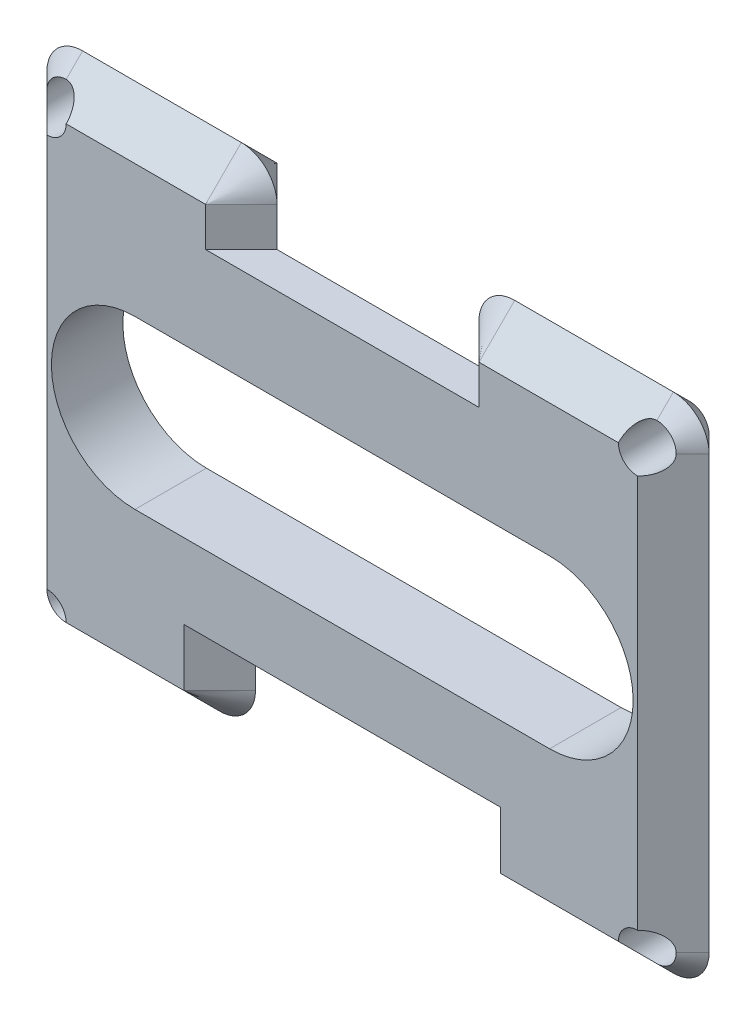
from build123d import *

# Parameters (mm, degrees)
SKETCH2_R           = 5.393909569
BOSS_EXTRUDE1_DEPTH = 10
SKETCH2_2_R         = 5.393909569
BOSS_EXTRUDE2_DEPTH = 20
CHAMFER1_SIZE       = 10
CHAMFER3_SIZE       = 10
CHAMFER4_SIZE       = 10
CHAMFER5_SIZE       = 10
CHAMFER6_SIZE       = 10


with BuildPart() as part:
    # Sketch2 → Boss-Extrude1 (new body)
    with BuildSketch(Plane.XY):
        with BuildLine():
            Line((-82.666209824, 70.437866658), (-38.259856652, 70.437866658))
            ThreePointArc((-38.259856652, 70.437866658), (-31.18878884, 67.50893447), (-28.259856652, 60.437866658))
            Line((-28.259856652, 60.437866658), (-28.259856652, 49.492772702))
            Line((-28.259856652, 49.492772702), (28.259856652, 49.492772702))
            Line((28.259856652, 49.492772702), (28.259856652, 60.437866658))
            ThreePointArc((28.259856652, 60.437866658), (31.18878884, 67.50893447), (38.259856652, 70.437866658))
            Line((38.259856652, 70.437866658), (82.666209824, 70.437866658))
            ThreePointArc((82.666209824, 70.437866658), (89.737277636, 67.50893447), (92.666209824, 60.437866658))
            Line((92.666209824, 60.437866658), (92.666209824, -60.437866658))
            ThreePointArc((92.666209824, -60.437866658), (89.737277636, -67.50893447), (82.666209824, -70.437866658))
            Line((82.666209824, -70.437866658), (44.297191223, -70.437866658))
            ThreePointArc((44.297191223, -70.437866658), (37.226123411, -67.50893447), (34.297191223, -60.437866658))
            Line((34.297191223, -60.437866658), (34.297191223, -54.409741631))
            Line((34.297191223, -54.409741631), (-34.297191223, -54.409741631))
            Line((-34.297191223, -54.409741631), (-34.297191223, -60.437866658))
            ThreePointArc((-34.297191223, -60.437866658), (-37.226123411, -67.50893447), (-44.297191223, -70.437866658))
            Line((-44.297191223, -70.437866658), (-82.666209824, -70.437866658))
            ThreePointArc((-82.666209824, -70.437866658), (-89.737277636, -67.50893447), (-92.666209824, -60.437866658))
            Line((-92.666209824, -60.437866658), (-92.666209824, 60.437866658))
            ThreePointArc((-92.666209824, 60.437866658), (-89.737277636, 67.50893447), (-82.666209824, 70.437866658))
        make_face()
        with Locations((82.666209824, -60.437866658)):
            Circle(SKETCH2_R, mode=Mode.SUBTRACT)
        with Locations((82.666209824, 60.437866658)):
            Circle(SKETCH2_R, mode=Mode.SUBTRACT)
        with Locations((-82.666209824, 60.437866658)):
            Circle(SKETCH2_R, mode=Mode.SUBTRACT)
        with Locations((-82.666209824, -60.437866658)):
            Circle(SKETCH2_R, mode=Mode.SUBTRACT)
        with BuildLine():
            Line((-58.024636058, 23.383062292), (58.024636058, 23.383062292))
            ThreePointArc((58.024636058, 23.383062292), (81.40769835, 0), (58.024636058, -23.383062292))
            Line((58.024636058, -23.383062292), (-58.024636058, -23.383062292))
            ThreePointArc((-58.024636058, -23.383062292), (-81.40769835, 0), (-58.024636058, 23.383062292))
        make_face(mode=Mode.SUBTRACT)
    extrude(amount=BOSS_EXTRUDE1_DEPTH)

    # Sketch2<2> → Boss-Extrude2 (add)
    with BuildSketch(Plane.XY):
        with BuildLine():
            Line((-82.666209824, 70.437866658), (-38.259856652, 70.437866658))
            ThreePointArc((-38.259856652, 70.437866658), (-31.18878884, 67.50893447), (-28.259856652, 60.437866658))
            Line((-28.259856652, 60.437866658), (-28.259856652, 49.492772702))
            Line((-28.259856652, 49.492772702), (28.259856652, 49.492772702))
            Line((28.259856652, 49.492772702), (28.259856652, 60.437866658))
            ThreePointArc((28.259856652, 60.437866658), (31.18878884, 67.50893447), (38.259856652, 70.437866658))
            Line((38.259856652, 70.437866658), (82.666209824, 70.437866658))
            ThreePointArc((82.666209824, 70.437866658), (89.737277636, 67.50893447), (92.666209824, 60.437866658))
            Line((92.666209824, 60.437866658), (92.666209824, -60.437866658))
            ThreePointArc((92.666209824, -60.437866658), (89.737277636, -67.50893447), (82.666209824, -70.437866658))
            Line((82.666209824, -70.437866658), (44.297191223, -70.437866658))
            ThreePointArc((44.297191223, -70.437866658), (37.226123411, -67.50893447), (34.297191223, -60.437866658))
            Line((34.297191223, -60.437866658), (34.297191223, -54.409741631))
            Line((34.297191223, -54.409741631), (-34.297191223, -54.409741631))
            Line((-34.297191223, -54.409741631), (-34.297191223, -60.437866658))
            ThreePointArc((-34.297191223, -60.437866658), (-37.226123411, -67.50893447), (-44.297191223, -70.437866658))
            Line((-44.297191223, -70.437866658), (-82.666209824, -70.437866658))
            ThreePointArc((-82.666209824, -70.437866658), (-89.737277636, -67.50893447), (-92.666209824, -60.437866658))
            Line((-92.666209824, -60.437866658), (-92.666209824, 60.437866658))
            ThreePointArc((-92.666209824, 60.437866658), (-89.737277636, 67.50893447), (-82.666209824, 70.437866658))
        make_face()
        with Locations((82.666209824, -60.437866658)):
            Circle(SKETCH2_2_R, mode=Mode.SUBTRACT)
        with Locations((82.666209824, 60.437866658)):
            Circle(SKETCH2_2_R, mode=Mode.SUBTRACT)
        with Locations((-82.666209824, 60.437866658)):
            Circle(SKETCH2_2_R, mode=Mode.SUBTRACT)
        with Locations((-82.666209824, -60.437866658)):
            Circle(SKETCH2_2_R, mode=Mode.SUBTRACT)
        with BuildLine():
            Line((-58.024636058, 23.383062292), (58.024636058, 23.383062292))
            ThreePointArc((58.024636058, 23.383062292), (81.40769835, 0), (58.024636058, -23.383062292))
            Line((58.024636058, -23.383062292), (-58.024636058, -23.383062292))
            ThreePointArc((-58.024636058, -23.383062292), (-81.40769835, 0), (-58.024636058, 23.383062292))
        make_face(mode=Mode.SUBTRACT)
    extrude(amount=BOSS_EXTRUDE2_DEPTH)

    # Chamfer1
    # the kernel refuses this chamfer: 10 mm, written as the material it takes off along each edge
    with BuildSketch(Plane(origin=(82.666209824, -70.437866658, 0), x_dir=(0, 1, 0), z_dir=(-1, 0, 0))) as chamfer1_piece_1:
        Polygon((CHAMFER1_SIZE, 0), (0, -CHAMFER1_SIZE), (0, 0), align=None)
    extrude(amount=38.369018602, mode=Mode.SUBTRACT)
    with BuildSketch(Plane(origin=(44.297191223, -60.437866658, 0), x_dir=(0, -1, 0), z_dir=(1, 0, 0))) as chamfer1_piece_2:
        Polygon((10 - CHAMFER1_SIZE, 0), (10, -CHAMFER1_SIZE), (10, 0), align=None)
    revolve(axis=Axis((44.297191223, -60.437866658, 0), (0, 0, -1)), revolution_arc=90, mode=Mode.SUBTRACT)
    with BuildSketch(Plane(origin=(34.297191223, -60.437866658, 0), x_dir=(1, 0, 0), z_dir=(0, 1, 0))) as chamfer1_piece_3:
        Polygon((CHAMFER1_SIZE, 0), (0, -CHAMFER1_SIZE), (0, 0), align=None)
    extrude(amount=6.028125027, mode=Mode.SUBTRACT)
    with BuildSketch(Plane(origin=(-28.259856652, 49.492772702, 0), x_dir=(0, -1, 0), z_dir=(1, 0, 0))) as chamfer1_piece_4:
        Polygon((CHAMFER1_SIZE, 0), (0, -CHAMFER1_SIZE), (0, 0), align=None)
    extrude(amount=56.519713304, mode=Mode.SUBTRACT)
    with BuildSketch(Plane(origin=(28.259856652, 49.492772702, 0), x_dir=(1, 0, 0), z_dir=(0, 1, 0))) as chamfer1_piece_5:
        Polygon((CHAMFER1_SIZE, 0), (0, -CHAMFER1_SIZE), (0, 0), align=None)
    extrude(amount=10.945093956, mode=Mode.SUBTRACT)
    with BuildSketch(Plane(origin=(38.259856652, 60.437866658, 0), x_dir=(-1, 0, 0), z_dir=(0, -1, 0))) as chamfer1_piece_6:
        Polygon((10 - CHAMFER1_SIZE, 0), (10, -CHAMFER1_SIZE), (10, 0), align=None)
    revolve(axis=Axis((38.259856652, 60.437866658, 0), (0, 0, -1)), revolution_arc=90, mode=Mode.SUBTRACT)
    with BuildSketch(Plane(origin=(38.259856652, 70.437866658, 0), x_dir=(0, -1, 0), z_dir=(1, 0, 0))) as chamfer1_piece_7:
        Polygon((CHAMFER1_SIZE, 0), (0, -CHAMFER1_SIZE), (0, 0), align=None)
    extrude(amount=44.406353173, mode=Mode.SUBTRACT)
    with BuildSketch(Plane(origin=(82.666209824, 60.437866658, 0), x_dir=(0, 1, 0), z_dir=(-1, 0, 0))) as chamfer1_piece_8:
        Polygon((10 - CHAMFER1_SIZE, 0), (10, -CHAMFER1_SIZE), (10, 0), align=None)
    revolve(axis=Axis((82.666209824, 60.437866658, 0), (0, 0, -1)), revolution_arc=90, mode=Mode.SUBTRACT)
    with BuildSketch(Plane(origin=(92.666209824, 60.437866658, 0), x_dir=(-1, 0, 0), z_dir=(0, -1, 0))) as chamfer1_piece_9:
        Polygon((CHAMFER1_SIZE, 0), (0, -CHAMFER1_SIZE), (0, 0), align=None)
    extrude(amount=120.875733316, mode=Mode.SUBTRACT)
    with BuildSketch(Plane(origin=(82.666209824, -60.437866658, 0), x_dir=(1, 0, 0), z_dir=(0, 1, 0))) as chamfer1_piece_10:
        Polygon((10 - CHAMFER1_SIZE, 0), (10, -CHAMFER1_SIZE), (10, 0), align=None)
    revolve(axis=Axis((82.666209824, -60.437866658, 0), (0, 0, -1)), revolution_arc=90, mode=Mode.SUBTRACT)
    with BuildSketch(Plane(origin=(-28.259856652, 49.492772702, 0), x_dir=(0, -1, 0), z_dir=(1, 0, 0))) as chamfer1_piece_11a_section:
        Polygon((CHAMFER1_SIZE, 0), (0, -CHAMFER1_SIZE), (0, 0), align=None)
    chamfer1_piece_11a = extrude(amount=82.236543183, mode=Mode.PRIVATE)
    chamfer1_piece_11a = split(chamfer1_piece_11a, bisect_by=Plane(origin=(28.259856652, 49.492772702, 0), z_dir=(1, 0, 0)), keep=Keep.TOP, mode=Mode.PRIVATE)
    with BuildSketch(Plane(origin=(28.259856652, 23.775942822, 0), x_dir=(1, 0, 0), z_dir=(0, 1, 0))) as chamfer1_piece_11b_section:
        Polygon((CHAMFER1_SIZE, 0), (0, -CHAMFER1_SIZE), (0, 0), align=None)
    chamfer1_piece_11b = extrude(amount=36.661923835, mode=Mode.PRIVATE)
    chamfer1_piece_11b = split(chamfer1_piece_11b, bisect_by=Plane(origin=(28.259856652, 49.492772702, 0), z_dir=(0, -1, 0)), keep=Keep.TOP, mode=Mode.PRIVATE)
    chamfer1_piece_11 = chamfer1_piece_11a & chamfer1_piece_11b
    add(chamfer1_piece_11, mode=Mode.SUBTRACT)

    # Chamfer3
    # the kernel refuses this chamfer: 10 mm, written as the material it takes off along each edge
    with BuildSketch(Plane(origin=(-34.297191223, -54.409741631, 0), x_dir=(-1, 0, 0), z_dir=(0, -1, 0))) as chamfer3_piece_1:
        Polygon((CHAMFER3_SIZE, 0), (0, -CHAMFER3_SIZE), (0, 0), align=None)
    extrude(amount=6.028125027, mode=Mode.SUBTRACT)
    with BuildSketch(Plane(origin=(-44.297191223, -60.437866658, 0), x_dir=(1, 0, 0), z_dir=(0, 1, 0))) as chamfer3_piece_2:
        Polygon((10, -CHAMFER3_SIZE), (10 - CHAMFER3_SIZE, 0), (10, 0), align=None)
    revolve(axis=Axis((-44.297191223, -60.437866658, 0), (0, 0, -1)), revolution_arc=90, mode=Mode.SUBTRACT)
    with BuildSketch(Plane(origin=(-44.297191223, -70.437866658, 0), x_dir=(0, 1, 0), z_dir=(-1, 0, 0))) as chamfer3_piece_3:
        Polygon((CHAMFER3_SIZE, 0), (0, -CHAMFER3_SIZE), (0, 0), align=None)
    extrude(amount=38.369018602, mode=Mode.SUBTRACT)
    with BuildSketch(Plane(origin=(-82.666209824, -60.437866658, 0), x_dir=(0, -1, 0), z_dir=(1, 0, 0))) as chamfer3_piece_4:
        Polygon((10 - CHAMFER3_SIZE, 0), (10, -CHAMFER3_SIZE), (10, 0), align=None)
    revolve(axis=Axis((-82.666209824, -60.437866658, 0), (0, 0, -1)), revolution_arc=90, mode=Mode.SUBTRACT)
    with BuildSketch(Plane(origin=(-92.666209824, -60.437866658, 0), x_dir=(1, 0, 0), z_dir=(0, 1, 0))) as chamfer3_piece_5:
        Polygon((CHAMFER3_SIZE, 0), (0, -CHAMFER3_SIZE), (0, 0), align=None)
    extrude(amount=120.875733316, mode=Mode.SUBTRACT)
    with BuildSketch(Plane(origin=(-82.666209824, 60.437866658, 0), x_dir=(-1, 0, 0), z_dir=(0, -1, 0))) as chamfer3_piece_6:
        Polygon((10 - CHAMFER3_SIZE, 0), (10, -CHAMFER3_SIZE), (10, 0), align=None)
    revolve(axis=Axis((-82.666209824, 60.437866658, 0), (0, 0, -1)), revolution_arc=90, mode=Mode.SUBTRACT)
    with BuildSketch(Plane(origin=(-82.666209824, 70.437866658, 0), x_dir=(0, -1, 0), z_dir=(1, 0, 0))) as chamfer3_piece_7:
        Polygon((CHAMFER3_SIZE, 0), (0, -CHAMFER3_SIZE), (0, 0), align=None)
    extrude(amount=44.406353173, mode=Mode.SUBTRACT)
    with BuildSketch(Plane(origin=(-38.259856652, 60.437866658, 0), x_dir=(0, 1, 0), z_dir=(-1, 0, 0))) as chamfer3_piece_8:
        Polygon((10 - CHAMFER3_SIZE, 0), (10, -CHAMFER3_SIZE), (10, 0), align=None)
    revolve(axis=Axis((-38.259856652, 60.437866658, 0), (0, 0, -1)), revolution_arc=90, mode=Mode.SUBTRACT)
    with BuildSketch(Plane(origin=(-28.259856652, 60.437866658, 0), x_dir=(-1, 0, 0), z_dir=(0, -1, 0))) as chamfer3_piece_9_section:
        Polygon((CHAMFER3_SIZE, 0), (0, -CHAMFER3_SIZE), (0, 0), align=None)
    chamfer3_piece_9 = extrude(amount=46.661923835, mode=Mode.PRIVATE)
    chamfer3_piece_9 = split(chamfer3_piece_9, bisect_by=Plane(origin=(-28.259856652, 49.492772702, 0), z_dir=(0, 1, 0)), keep=Keep.TOP, mode=Mode.PRIVATE)
    chamfer3_piece_9 = split(chamfer3_piece_9, bisect_by=Plane(origin=(-28.259856652, 49.96531968, 10.472546978), z_dir=(0, 0.7071067811865476, -0.7071067811865476)), keep=Keep.TOP, mode=Mode.PRIVATE)
    add(chamfer3_piece_9, mode=Mode.SUBTRACT)
    with BuildSketch(Plane(origin=(-28.259856652, 60.437866658, 0), x_dir=(-1, 0, 0), z_dir=(0, -1, 0))) as chamfer3_piece_10_section:
        Polygon((CHAMFER3_SIZE, 0), (0, -CHAMFER3_SIZE), (0, 0), align=None)
    chamfer3_piece_10 = extrude(amount=46.661923835, mode=Mode.PRIVATE)
    chamfer3_piece_10 = split(chamfer3_piece_10, bisect_by=Plane(origin=(-28.259856652, 49.492772702, 0), z_dir=(0, -1, 0)), keep=Keep.TOP, mode=Mode.PRIVATE)
    chamfer3_piece_10 = split(chamfer3_piece_10, bisect_by=Plane(origin=(-28.259856652, 49.96531968, 10.472546978), z_dir=(0, 0.7071067811865476, -0.7071067811865476)), keep=Keep.TOP, mode=Mode.PRIVATE)
    add(chamfer3_piece_10, mode=Mode.SUBTRACT)

    # Chamfer4
    # the kernel refuses this chamfer: 10 mm, written as the material it takes off along each edge
    with BuildSketch(Plane(origin=(28.259856652, 49.492772702, 20), x_dir=(1, 0, 0), z_dir=(0, 1, 0))) as chamfer4_piece_1:
        Polygon((CHAMFER4_SIZE, 0), (0, CHAMFER4_SIZE), (0, 0), align=None)
    extrude(amount=10.945093956, mode=Mode.SUBTRACT)
    with BuildSketch(Plane(origin=(38.259856652, 60.437866658, 20), x_dir=(-1, 0, 0), z_dir=(0, -1, 0))) as chamfer4_piece_2:
        Polygon((10 - CHAMFER4_SIZE, 0), (10, CHAMFER4_SIZE), (10, 0), align=None)
    revolve(axis=Axis((38.259856652, 60.437866658, 20), (0, 0, -1)), revolution_arc=90, mode=Mode.SUBTRACT)
    with BuildSketch(Plane(origin=(38.259856652, 70.437866658, 20), x_dir=(0, -1, 0), z_dir=(1, 0, 0))) as chamfer4_piece_3:
        Polygon((CHAMFER4_SIZE, 0), (0, CHAMFER4_SIZE), (0, 0), align=None)
    extrude(amount=44.406353173, mode=Mode.SUBTRACT)
    with BuildSketch(Plane(origin=(82.666209824, 60.437866658, 20), x_dir=(0, 1, 0), z_dir=(-1, 0, 0))) as chamfer4_piece_4:
        Polygon((10 - CHAMFER4_SIZE, 0), (10, CHAMFER4_SIZE), (10, 0), align=None)
    revolve(axis=Axis((82.666209824, 60.437866658, 20), (0, 0, -1)), revolution_arc=90, mode=Mode.SUBTRACT)
    with BuildSketch(Plane(origin=(92.666209824, 60.437866658, 20), x_dir=(-1, 0, 0), z_dir=(0, -1, 0))) as chamfer4_piece_5:
        Polygon((CHAMFER4_SIZE, 0), (0, CHAMFER4_SIZE), (0, 0), align=None)
    extrude(amount=120.875733316, mode=Mode.SUBTRACT)
    with BuildSketch(Plane(origin=(82.666209824, -60.437866658, 20), x_dir=(1, 0, 0), z_dir=(0, 1, 0))) as chamfer4_piece_6:
        Polygon((10 - CHAMFER4_SIZE, 0), (10, CHAMFER4_SIZE), (10, 0), align=None)
    revolve(axis=Axis((82.666209824, -60.437866658, 20), (0, 0, -1)), revolution_arc=90, mode=Mode.SUBTRACT)
    with BuildSketch(Plane(origin=(82.666209824, -70.437866658, 20), x_dir=(0, 1, 0), z_dir=(-1, 0, 0))) as chamfer4_piece_7:
        Polygon((CHAMFER4_SIZE, 0), (0, CHAMFER4_SIZE), (0, 0), align=None)
    extrude(amount=38.369018602, mode=Mode.SUBTRACT)
    with BuildSketch(Plane(origin=(44.297191223, -60.437866658, 20), x_dir=(0, -1, 0), z_dir=(1, 0, 0))) as chamfer4_piece_8:
        Polygon((10 - CHAMFER4_SIZE, 0), (10, CHAMFER4_SIZE), (10, 0), align=None)
    revolve(axis=Axis((44.297191223, -60.437866658, 20), (0, 0, -1)), revolution_arc=90, mode=Mode.SUBTRACT)
    with BuildSketch(Plane(origin=(34.297191223, -60.437866658, 20), x_dir=(1, 0, 0), z_dir=(0, 1, 0))) as chamfer4_piece_9:
        Polygon((CHAMFER4_SIZE, 0), (0, CHAMFER4_SIZE), (0, 0), align=None)
    extrude(amount=6.028125027, mode=Mode.SUBTRACT)

    # Chamfer5
    chamfer5_edges = [part.edges().sort_by_distance(p)[0] for p in [
        (5, -54.409741631, 20),
    ]]
    chamfer(chamfer5_edges, length=CHAMFER5_SIZE)

    # Chamfer6
    # the kernel refuses this chamfer: 10 mm, written as the material it takes off along each edge
    with BuildSketch(Plane(origin=(-28.259856652, 60.437866658, 20), x_dir=(-1, 0, 0), z_dir=(0, -1, 0))) as chamfer6_piece_1:
        Polygon((CHAMFER6_SIZE, 0), (0, CHAMFER6_SIZE), (0, 0), align=None)
    extrude(amount=10.945093956, mode=Mode.SUBTRACT)
    with BuildSketch(Plane(origin=(-38.259856652, 60.437866658, 20), x_dir=(0, 1, 0), z_dir=(-1, 0, 0))) as chamfer6_piece_2:
        Polygon((10 - CHAMFER6_SIZE, 0), (10, CHAMFER6_SIZE), (10, 0), align=None)
    revolve(axis=Axis((-38.259856652, 60.437866658, 20), (0, 0, -1)), revolution_arc=90, mode=Mode.SUBTRACT)
    with BuildSketch(Plane(origin=(-82.666209824, 70.437866658, 20), x_dir=(0, -1, 0), z_dir=(1, 0, 0))) as chamfer6_piece_3:
        Polygon((CHAMFER6_SIZE, 0), (0, CHAMFER6_SIZE), (0, 0), align=None)
    extrude(amount=44.406353173, mode=Mode.SUBTRACT)
    with BuildSketch(Plane(origin=(-82.666209824, 60.437866658, 20), x_dir=(-1, 0, 0), z_dir=(0, -1, 0))) as chamfer6_piece_4:
        Polygon((10 - CHAMFER6_SIZE, 0), (10, CHAMFER6_SIZE), (10, 0), align=None)
    revolve(axis=Axis((-82.666209824, 60.437866658, 20), (0, 0, -1)), revolution_arc=90, mode=Mode.SUBTRACT)
    with BuildSketch(Plane(origin=(-92.666209824, -60.437866658, 20), x_dir=(1, 0, 0), z_dir=(0, 1, 0))) as chamfer6_piece_5:
        Polygon((CHAMFER6_SIZE, 0), (0, CHAMFER6_SIZE), (0, 0), align=None)
    extrude(amount=120.875733316, mode=Mode.SUBTRACT)
    with BuildSketch(Plane(origin=(-82.666209824, -60.437866658, 20), x_dir=(0, -1, 0), z_dir=(1, 0, 0))) as chamfer6_piece_6:
        Polygon((10 - CHAMFER6_SIZE, 0), (10, CHAMFER6_SIZE), (10, 0), align=None)
    revolve(axis=Axis((-82.666209824, -60.437866658, 20), (0, 0, -1)), revolution_arc=90, mode=Mode.SUBTRACT)
    with BuildSketch(Plane(origin=(-44.297191223, -70.437866658, 20), x_dir=(0, 1, 0), z_dir=(-1, 0, 0))) as chamfer6_piece_7:
        Polygon((CHAMFER6_SIZE, 0), (0, CHAMFER6_SIZE), (0, 0), align=None)
    extrude(amount=38.369018602, mode=Mode.SUBTRACT)
    with BuildSketch(Plane(origin=(-44.297191223, -60.437866658, 20), x_dir=(1, 0, 0), z_dir=(0, 1, 0))) as chamfer6_piece_8:
        Polygon((10 - CHAMFER6_SIZE, 0), (10, CHAMFER6_SIZE), (10, 0), align=None)
    revolve(axis=Axis((-44.297191223, -60.437866658, 20), (0, 0, -1)), revolution_arc=90, mode=Mode.SUBTRACT)
    with BuildSketch(Plane(origin=(-34.297191223, -60.437866658, 20), x_dir=(-1, 0, 0), z_dir=(0, 1, 0))) as chamfer6_piece_9_section:
        Polygon((CHAMFER6_SIZE, 0), (0, -CHAMFER6_SIZE), (0, 0), align=None)
    chamfer6_piece_9 = extrude(amount=41.744954906, mode=Mode.PRIVATE)
    chamfer6_piece_9 = split(chamfer6_piece_9, bisect_by=Plane(origin=(-34.297191223, -52.423804144, 11.985937487), z_dir=(0, -0.7071067811865476, 0.7071067811865476)), keep=Keep.TOP, mode=Mode.PRIVATE)
    add(chamfer6_piece_9, mode=Mode.SUBTRACT)


solid = part.part
